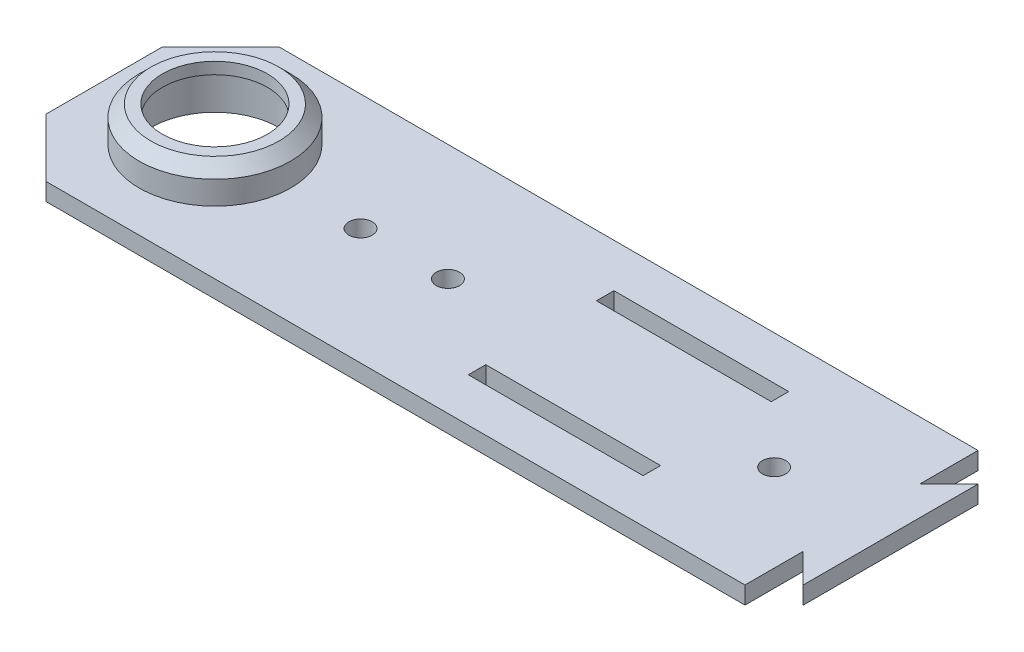
from build123d import *

# Parameters (mm, degrees)
CROQUIS1_R              = 11
CROQUIS1_R_2            = 2
CROQUIS1_W              = 30
CROQUIS1_H              = 3
SALIENTE_EXTRUIR1_DEPTH = 3
CROQUIS2_R              = 13
CROQUIS2_R_2            = 11
SALIENTE_EXTRUIR2_DEPTH = 4
CROQUIS3_R              = 13
CROQUIS3_R_2            = 9
SALIENTE_EXTRUIR3_DEPTH = 2
CHAFL_N1_SIZE           = 2
CHAFL_N2_SIZE           = 10


with BuildPart() as part:
    # Croquis1 → Saliente-Extruir1 (new body)
    with BuildSketch(Plane(origin=(0, 0, 0), x_dir=(1, 0, 0), z_dir=(0, 1, 0))):
        Polygon((65, 10), (70, 15), (70, -15), (65, -10), (65, -20), (-65, -20), (-65, 20), (65, 20), align=None)
        with Locations((-46, 0)):
            Circle(CROQUIS1_R, mode=Mode.SUBTRACT)
        with Locations((-21, 0)):
            Circle(CROQUIS1_R_2, mode=Mode.SUBTRACT)
        with Locations((-6, 0)):
            Circle(CROQUIS1_R_2, mode=Mode.SUBTRACT)
        with Locations((50, 0)):
            Circle(CROQUIS1_R_2, mode=Mode.SUBTRACT)
        with Locations((25, 11)):
            Rectangle(CROQUIS1_W, CROQUIS1_H, mode=Mode.SUBTRACT)
        with Locations((25, -11)):
            Rectangle(CROQUIS1_W, CROQUIS1_H, mode=Mode.SUBTRACT)
    extrude(amount=SALIENTE_EXTRUIR1_DEPTH)

    # Croquis2 → Saliente-Extruir2 (add)
    with BuildSketch(Plane(origin=(0, 3, 0), x_dir=(1, 0, 0), z_dir=(0, 1, 0))):
        with Locations((-46, 0)):
            Circle(CROQUIS2_R)
        with Locations((-46, 0)):
            Circle(CROQUIS2_R_2, mode=Mode.SUBTRACT)
    extrude(amount=SALIENTE_EXTRUIR2_DEPTH)

    # Croquis3 → Saliente-Extruir3 (add)
    with BuildSketch(Plane(origin=(0, 7, 0), x_dir=(1, 0, 0), z_dir=(0, 1, 0))):
        with Locations((-46, 0)):
            Circle(CROQUIS3_R)
        with Locations((-46, 0)):
            Circle(CROQUIS3_R_2, mode=Mode.SUBTRACT)
    extrude(amount=SALIENTE_EXTRUIR3_DEPTH)

    # Chaflán1
    chafl_n1_edges = [part.edges().sort_by_distance(p)[0] for p in [
        (-59, 9, 0),
    ]]
    chamfer(chafl_n1_edges, length=CHAFL_N1_SIZE)

    # Chaflán2
    chafl_n2_edges = [part.edges().sort_by_distance(p)[0] for p in [
        (-65, 1.5, 20),
        (-65, 1.5, -20),
    ]]
    chamfer(chafl_n2_edges, length=CHAFL_N2_SIZE)


solid = part.part
